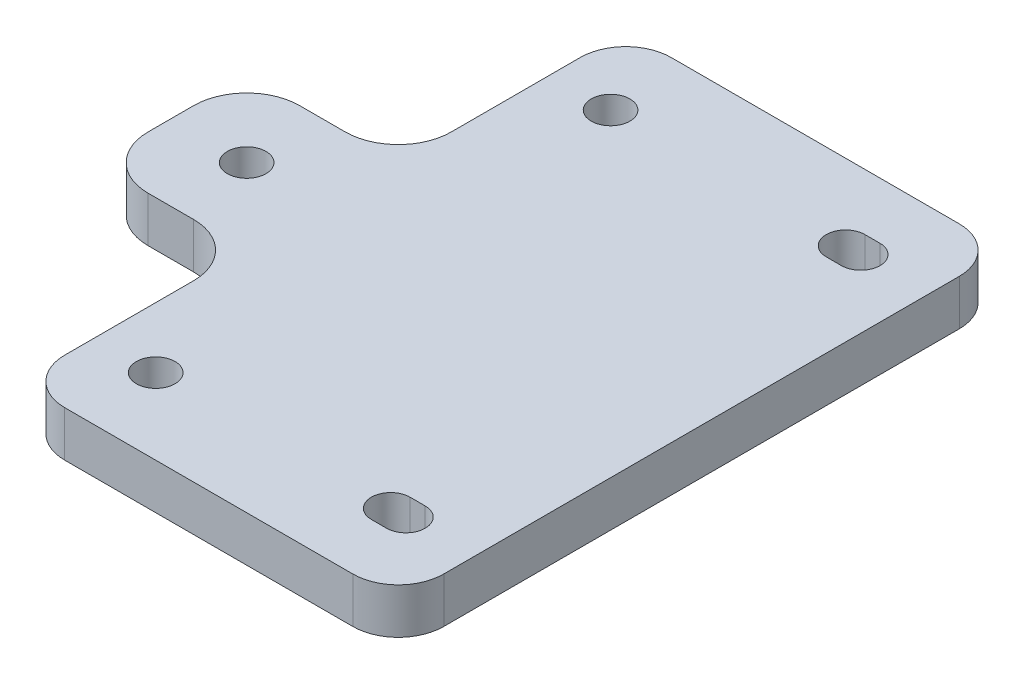
from build123d import *

# Parameters (mm, degrees)
SKETCH_1_R          = 2.55
EXTRUDE_1_DEPTH     = 6
SKETCH_2_R          = 2.55
CUT_EXTRUDE_1_DEPTH = 61.50619803


with BuildPart() as part:
    # Эскиз1 → Бобышка-Вытянуть1 (new body)
    with BuildSketch(Plane(origin=(0, 0, 0), x_dir=(1, 0, 0), z_dir=(0, 1, 0))):
        with BuildLine():
            Line((-32, -10), (-38, -10))
            ThreePointArc((-38, -10), (-42.949747468, -7.949747468), (-45, -3))
            Line((-45, -3), (-45, 3))
            ThreePointArc((-45, 3), (-42.949747468, 7.949747468), (-38, 10))
            Line((-38, 10), (-32, 10))
            ThreePointArc((-32, 10), (-27.050252532, 12.050252532), (-25, 17))
            Line((-25, 17), (-25, 34))
            ThreePointArc((-25, 34), (-23.242640687, 38.242640687), (-19, 40))
            Line((-19, 40), (19, 40))
            ThreePointArc((19, 40), (23.242640687, 38.242640687), (25, 34))
            Line((25, 34), (25, -34))
            ThreePointArc((25, -34), (23.242640687, -38.242640687), (19, -40))
            Line((19, -40), (-19, -40))
            ThreePointArc((-19, -40), (-23.242640687, -38.242640687), (-25, -34))
            Line((-25, -34), (-25, -17))
            ThreePointArc((-25, -17), (-27.050252532, -12.050252532), (-32, -10))
        make_face()
        with Locations((-35, 0)):
            Circle(SKETCH_1_R, mode=Mode.SUBTRACT)
    extrude(amount=EXTRUDE_1_DEPTH)

    # Эскиз2 → Вырез-Вытянуть1 (cut, through all)
    with BuildSketch(Plane.XZ):
        with Locations((-17, -30)):
            Circle(SKETCH_2_R)
        with Locations((-17, 30)):
            Circle(SKETCH_2_R)
        with BuildLine():
            Line((16, -32.55), (14, -32.55))
            ThreePointArc((14, -32.55), (11.45, -30), (14, -27.45))
            Line((14, -27.45), (16, -27.45))
            ThreePointArc((16, -27.45), (18.55, -30), (16, -32.55))
        make_face()
        with BuildLine():
            Line((16, 32.55), (14, 32.55))
            ThreePointArc((14, 32.55), (11.45, 30), (14, 27.45))
            Line((14, 27.45), (16, 27.45))
            ThreePointArc((16, 27.45), (18.55, 30), (16, 32.55))
        make_face()
    extrude(amount=-CUT_EXTRUDE_1_DEPTH, mode=Mode.SUBTRACT)


solid = part.part
